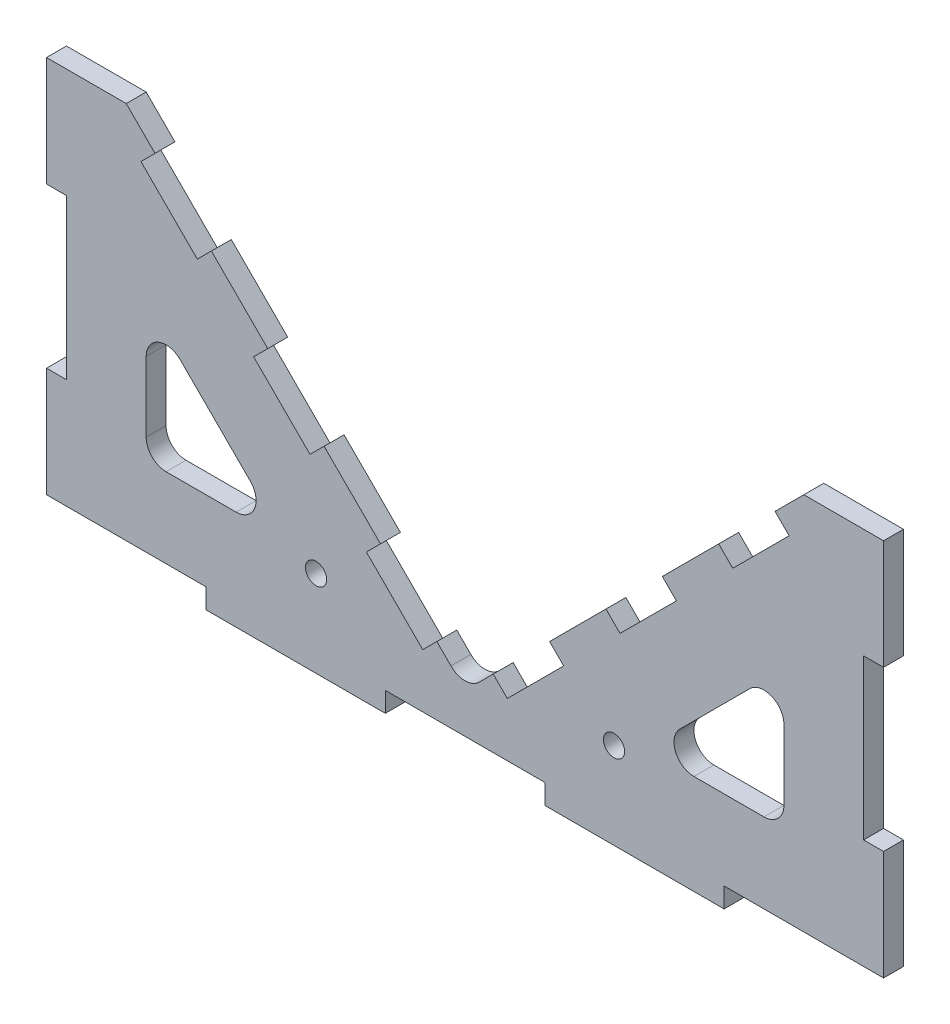
from build123d import *

# Parameters (mm, degrees)
BOSS_EXTRUDE1_DEPTH     = 3.175
CUT_EXTRUDE1_DEPTH      = 178.828345955
CAVITY1_START           = 31.75
CAVITY1_OUTLINE_W       = 6.35
CAVITY1_OUTLINE_H       = 6.35
CAVITY1_DEPTH           = 50.8
FILLET1_R               = 6.35
CUT_EXTRUDE2_DEPTH      = 178.828345955
FILLET2_R               = 6.35
F_1_4_CLEARANCE_HOLE1_D = 6.7564


# Read off the part's stored shape, not the designer's step: Cavity1
with BuildPart() as part:
    # Sketch1 → Boss-Extrude1 (new, symmetric)
    with BuildSketch(Plane.XY):
        Polygon((133.35, -3.175), (133.35, 117.475), (107.95, 117.475), (0, 9.525), (-107.95, 117.475), (-133.35, 117.475), (-133.35, -3.175), (-82.55, -3.175), (-82.55, -9.525), (-25.4, -9.525), (-25.4, -3.175), (25.4, -3.175), (25.4, -9.525), (82.55, -9.525), (82.55, -3.175), align=None)
    extrude(amount=BOSS_EXTRUDE1_DEPTH, both=True)

    # Sketch2 → Cut-Extrude1 (cut, through all)
    with BuildSketch(Plane.XY.offset(3.175)):
        Polygon((-8.980256121, 18.505256121), (-13.470384182, 14.015128061), (-31.430896424, 31.975640303), (-26.940768363, 36.465768363), align=None)
        Polygon((-62.861792847, 72.386792847), (-67.351920908, 67.896664787), (-49.391408666, 49.936152545), (-44.901280605, 54.426280605), align=None)
        Polygon((-98.782817332, 108.307817332), (-103.272945392, 103.817689271), (-85.31243315, 85.857177029), (-80.82230509, 90.34730509), align=None)
        Polygon((80.82230509, 90.34730509), (98.782817332, 108.307817332), (103.272945392, 103.817689271), (85.31243315, 85.857177029), align=None)
        Polygon((44.901280605, 54.426280605), (62.861792847, 72.386792847), (67.351920908, 67.896664787), (49.391408666, 49.936152545), align=None)
        Polygon((26.940768363, 36.465768363), (31.430896424, 31.975640303), (13.470384182, 14.015128061), (8.980256121, 18.505256121), align=None)
    extrude(amount=-CUT_EXTRUDE1_DEPTH, mode=Mode.SUBTRACT)

    # Cavity1 outline → Cavity1 (cut)
    with BuildSketch(Plane(origin=(0, 0, 0), x_dir=(1, 0, 0), z_dir=(0, 1, 0)).offset(CAVITY1_START)):
        with Locations((130.175, 0)):
            Rectangle(CAVITY1_OUTLINE_W, CAVITY1_OUTLINE_H)
        with Locations((-130.175, 0)):
            Rectangle(CAVITY1_OUTLINE_W, CAVITY1_OUTLINE_H)
    extrude(amount=CAVITY1_DEPTH, mode=Mode.SUBTRACT)

    # Fillet1
    fillet1_edges = [part.edges().sort_by_distance(p)[0] for p in [
        (0, 9.525, 0),
    ]]
    fillet(fillet1_edges, radius=FILLET1_R)

    # Sketch3 → Cut-Extrude2 (cut, through all)
    with BuildSketch(Plane.XY.offset(3.175)):
        Polygon((-101.6, 66.223719395), (-57.601280605, 22.225), (-101.6, 22.225), (-101.6, 31.75), align=None)
    cut_extrude2 = extrude(amount=-CUT_EXTRUDE2_DEPTH, mode=Mode.SUBTRACT)

    # Mirror1: Cut-Extrude2 across plane
    add(cut_extrude2.mirror(Plane(origin=(0, 0, 0), x_dir=(0, 0, 1), z_dir=(1, 0, 0))), mode=Mode.SUBTRACT)

    # Fillet2
    fillet2_edges = [part.edges().sort_by_distance(p)[0] for p in [
        (-57.601280605, 22.225, 0),
        (-101.6, 22.225, 0),
        (-101.6, 66.223719395, 0),
        (101.6, 22.225, 0),
        (57.601280605, 22.225, 0),
        (101.6, 66.223719395, 0),
    ]]
    fillet(fillet2_edges, radius=FILLET2_R)

    # 1/4 Clearance Hole1 (through all)
    with Locations(Plane.XY.offset(3.175)):
        with Locations((-47.473930622, 18.030114286)):
            f_1_4_clearance_hole1 = Hole(F_1_4_CLEARANCE_HOLE1_D / 2)

    # Mirror2: 1/4 Clearance Hole1 across plane
    add(f_1_4_clearance_hole1.mirror(Plane(origin=(0, 0, 0), x_dir=(0, 0, 1), z_dir=(1, 0, 0))), mode=Mode.SUBTRACT)


solid = part.part
